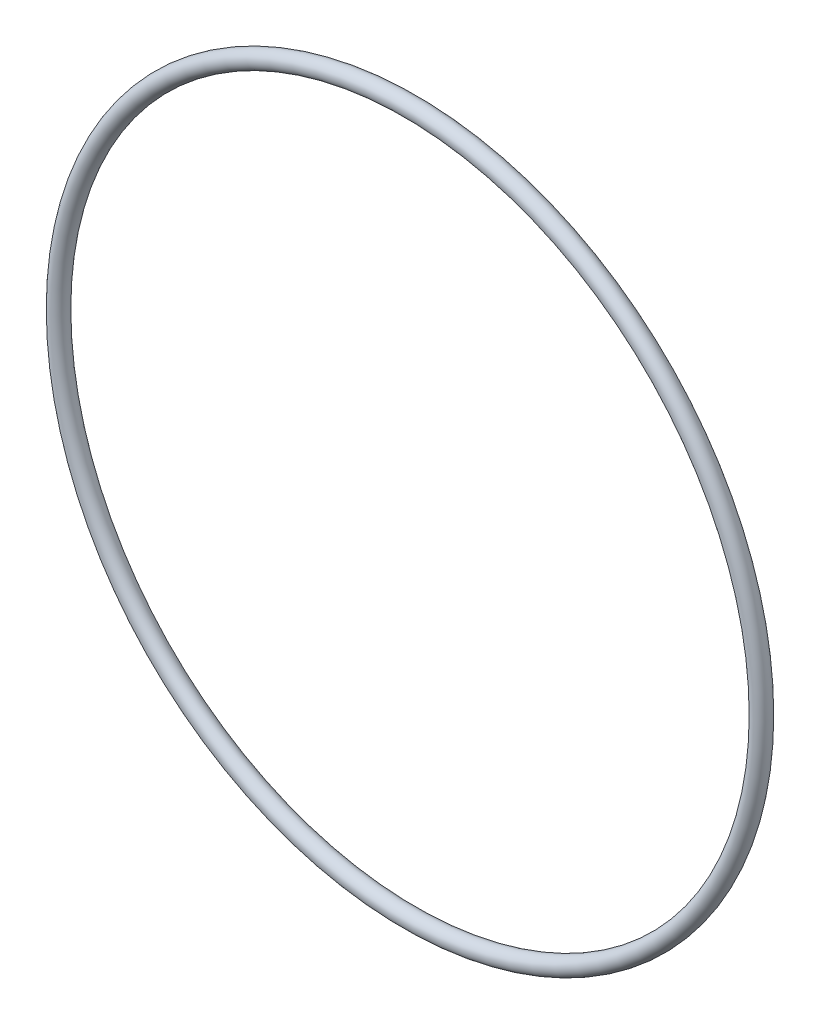
from build123d import *

# Parameters (mm, degrees)
SKETCH2_R = 1.7653


with BuildPart() as part:
    # Sketch2 → Revolve1 (revolve)
    with BuildSketch(Plane(origin=(0, 0, 0), x_dir=(1, 0, 0), z_dir=(0, 1, 0))):
        with Locations((-71.4121, 0)):
            Circle(SKETCH2_R)
    revolve(axis=Axis((0, 0, 1.7653), (0, 0, -1)))


solid = part.part
